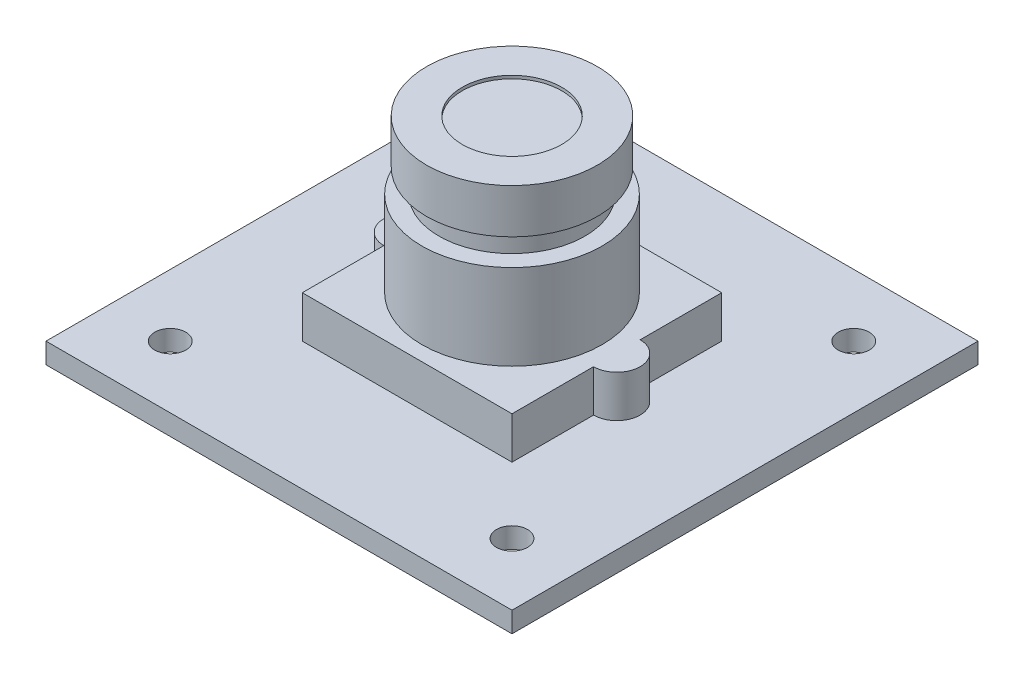
from build123d import *

# Parameters (mm, degrees)
SKETCH1_W           = 38.1
SKETCH1_H           = 38.1
SKETCH1_R           = 1.27
BOSS_EXTRUDE1_DEPTH = 1.6764
BOSS_EXTRUDE2_DEPTH = 3.429
SKETCH3_R           = 7.366
BOSS_EXTRUDE3_DEPTH = 6.985
SKETCH4_R           = 5.969
BOSS_EXTRUDE4_DEPTH = 1.905
SKETCH5_R           = 6.985
BOSS_EXTRUDE5_DEPTH = 3.6322
SKETCH6_R           = 4.064
CUT_EXTRUDE1_DEPTH  = 0.254
SKETCH7_W           = 10.033
SKETCH7_H           = 4.7244
SKETCH7_W_2         = 8.763
SKETCH7_H_2         = 3.4544
BOSS_EXTRUDE6_DEPTH = 6.604
CUT_EXTRUDE2_REACH  = 41.725
SKETCH9_W           = 3.175
SKETCH9_H           = 6.604


with BuildPart() as part:
    # Sketch1 → Boss-Extrude1 (new body)
    with BuildSketch(Plane(origin=(0, 0, 0), x_dir=(1, 0, 0), z_dir=(0, 1, 0))):
        Rectangle(SKETCH1_W, SKETCH1_H)
        with Locations((-13.97, 13.97)):
            Circle(SKETCH1_R, mode=Mode.SUBTRACT)
        with Locations((-13.97, -13.97)):
            Circle(SKETCH1_R, mode=Mode.SUBTRACT)
        with Locations((13.97, -13.97)):
            Circle(SKETCH1_R, mode=Mode.SUBTRACT)
        with Locations((13.97, 13.97)):
            Circle(SKETCH1_R, mode=Mode.SUBTRACT)
    extrude(amount=BOSS_EXTRUDE1_DEPTH)

    # Sketch2 → Boss-Extrude2 (add)
    with BuildSketch(Plane(origin=(0, 1.6764, 0), x_dir=(1, 0, 0), z_dir=(0, 1, 0))):
        with BuildLine():
            Line((-8.5725, -1.905), (-8.5725, -8.5725))
            Line((-8.5725, -8.5725), (8.5725, -8.5725))
            Line((8.5725, -8.5725), (8.5725, -1.905))
            ThreePointArc((8.5725, -1.905), (10.4775, 0), (8.5725, 1.905))
            Line((8.5725, 1.905), (8.5725, 8.5725))
            Line((8.5725, 8.5725), (-8.5725, 8.5725))
            Line((-8.5725, 8.5725), (-8.5725, 1.905))
            ThreePointArc((-8.5725, 1.905), (-10.4775, 0), (-8.5725, -1.905))
        make_face()
    extrude(amount=BOSS_EXTRUDE2_DEPTH)

    # Sketch3 → Boss-Extrude3 (add)
    with BuildSketch(Plane(origin=(0, 5.1054, 0), x_dir=(1, 0, 0), z_dir=(0, 1, 0))):
        Circle(SKETCH3_R)
    extrude(amount=BOSS_EXTRUDE3_DEPTH)

    # Sketch4 → Boss-Extrude4 (add)
    with BuildSketch(Plane(origin=(0, 12.0904, 0), x_dir=(1, 0, 0), z_dir=(0, 1, 0))):
        Circle(SKETCH4_R)
    extrude(amount=BOSS_EXTRUDE4_DEPTH)

    # Sketch5 → Boss-Extrude5 (add)
    with BuildSketch(Plane(origin=(0, 13.9954, 0), x_dir=(1, 0, 0), z_dir=(0, 1, 0))):
        Circle(SKETCH5_R)
    extrude(amount=BOSS_EXTRUDE5_DEPTH)

    # Sketch6 → Cut-Extrude1 (cut)
    with BuildSketch(Plane(origin=(0, 17.6276, 0), x_dir=(1, 0, 0), z_dir=(0, 1, 0))):
        Circle(SKETCH6_R)
    extrude(amount=-CUT_EXTRUDE1_DEPTH, mode=Mode.SUBTRACT)

    # Sketch7 → Boss-Extrude6 (add)
    with BuildSketch(Plane.XZ):
        with Locations((-5.9055, -13.3858)):
            Rectangle(SKETCH7_W, SKETCH7_H)
        with Locations((-5.9055, -13.3858)):
            Rectangle(SKETCH7_W_2, SKETCH7_H_2, mode=Mode.SUBTRACT)
    extrude(amount=BOSS_EXTRUDE6_DEPTH)

    # Sketch9 → Cut-Extrude2 (cut, up to next)
    with BuildSketch(Plane.XY.offset(-11.0236), mode=Mode.PRIVATE) as cut_extrude2_sk1:
        with Locations((-5.9055, -3.302)):
            Rectangle(SKETCH9_W, SKETCH9_H)
    cut_extrude2_tool1 = extrude(cut_extrude2_sk1.sketch, amount=-CUT_EXTRUDE2_REACH, mode=Mode.PRIVATE) & part.part
    add(cut_extrude2_tool1.solids().sort_by_distance((-5.9055, -3.302, -11.0236))[0], mode=Mode.SUBTRACT)


solid = part.part
